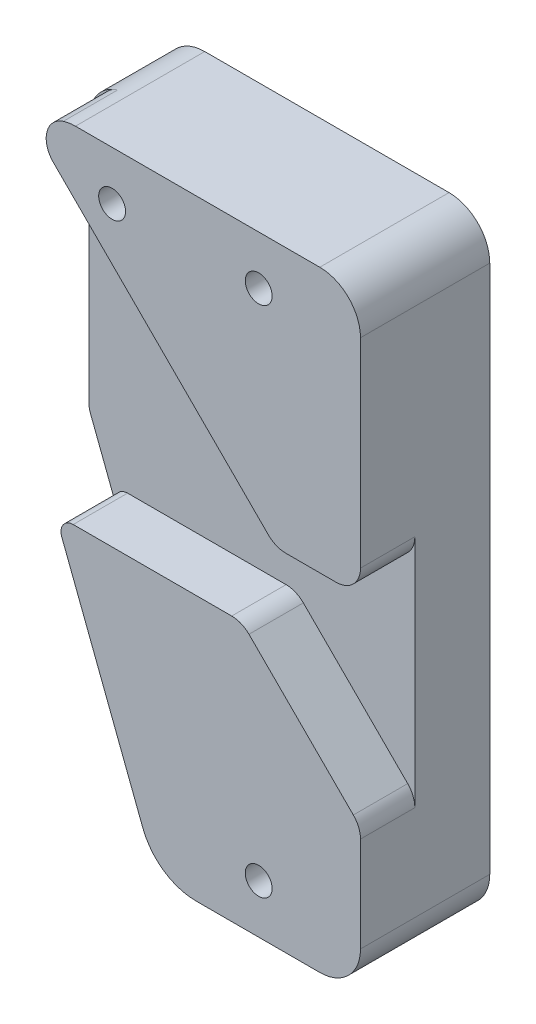
from build123d import *
from build123d.topology import SkipClean

# Parameters (mm, degrees)
SKETCH1_R           = 1.5
SKETCH1_W           = 15
SKETCH1_H           = 37.5
BOSS_EXTRUDE1_DEPTH = 2.85
FILLET1_R           = 5
FILLET2_R           = 2
BOSS_EXTRUDE2_START = 3.5
SKETCH5_R           = 1.5
BOSS_EXTRUDE2_DEPTH = 3.5
FILLET3_R           = 3.5
FILLET4_R           = 2
FILLET5_R           = 2
SKETCH6_R           = 1.5
CUT_EXTRUDE1_DEPTH  = 10
SKETCH8_R           = 1.5
BOSS_EXTRUDE3_DEPTH = 6.35
BOSS_EXTRUDE4_START = 3.175
SKETCH9_R           = 1.5
BOSS_EXTRUDE4_DEPTH = 3.175
SKETCH10_W          = 40
SKETCH10_H          = 15.399494937
SKETCH10_W_2        = 25
BOSS_EXTRUDE5_DEPTH = 6.675
CUT_EXTRUDE2_START  = -6.675
CUT_EXTRUDE2_DEPTH  = 6.675
BOSS_EXTRUDE6_START = -9.2
BOSS_EXTRUDE6_DEPTH = 9.2
FILLET6_R           = 7
BOSS_EXTRUDE7_DEPTH = 6.675
FILLET7_R           = 3
FILLET8_R           = 1.5
SKETCH15_R          = 1.65
CUT_EXTRUDE3_DEPTH  = 81.63507689


# Read off the part's stored shape, not the designer's step: Cut-Extrude2
with BuildPart() as part:
    # Sketch1 → Boss-Extrude1 (new body)
    # profile 1 of 2: a face of its own
    with BuildSketch(Plane.XY):
        Polygon((0, 37.5), (0, 0), (25, 0), (25, 75), (0, 75), align=None)
        with Locations((12.5, 6)):
            Circle(SKETCH1_R, mode=Mode.SUBTRACT)
        with Locations((12.5, 37.5)):
            Circle(SKETCH1_R, mode=Mode.SUBTRACT)
        with Locations((12.5, 69)):
            Circle(SKETCH1_R, mode=Mode.SUBTRACT)
    # profile 2 of 2: a face of its own
    with BuildSketch(Plane.XY):
        with Locations((-7.5, 56.25)):
            Rectangle(SKETCH1_W, SKETCH1_H)
    extrude(amount=BOSS_EXTRUDE1_DEPTH)

    # Fillet1
    fillet1_edges = [part.edges().sort_by_distance(p)[0] for p in [
        (25, 75, 1.425),
        (25, 0, 1.425),
        (0, 0, 1.425),
        (0, 37.5, 1.425),
        (-15, 75, 1.425),
    ]]
    fillet(fillet1_edges, radius=FILLET1_R)

    # Fillet2
    fillet2_edges = [part.edges().sort_by_distance(p)[0] for p in [
        (-15, 37.5, 1.425),
    ]]
    fillet(fillet2_edges, radius=FILLET2_R)

    # Sketch5 → Boss-Extrude2 (add)
    # profile 1 of 2: a face of its own
    with BuildSketch(Plane.XY.offset(2.85).offset(BOSS_EXTRUDE2_START)):
        with BuildLine():
            Line((-15, 42.5), (10.428932188, 42.5))
            Line((10.428932188, 42.5), (21.464466094, 53.535533906))
            Line((21.464466094, 53.535533906), (25, 57.071067812))
            Line((25, 57.071067812), (25, 70))
            ThreePointArc((25, 70), (23.535533906, 73.535533906), (20, 75))
            Line((20, 75), (-10, 75))
            ThreePointArc((-10, 75), (-13.535533906, 73.535533906), (-15, 70))
            Line((-15, 70), (-15, 42.5))
        make_face()
        with Locations((12.5, 69)):
            Circle(SKETCH5_R, mode=Mode.SUBTRACT)
    # profile 2 of 2: a face of its own
    with BuildSketch(Plane.XY.offset(2.85).offset(BOSS_EXTRUDE2_START)):
        with BuildLine():
            Line((14.571067812, 32.5), (0, 17.928932188))
            Line((0, 17.928932188), (0, 5))
            ThreePointArc((0, 5), (1.464466094, 1.464466094), (5, 0))
            Line((5, 0), (20, 0))
            ThreePointArc((20, 0), (23.535533906, 1.464466094), (25, 5))
            Line((25, 5), (25, 32.5))
            Line((25, 32.5), (14.571067812, 32.5))
        make_face()
        with Locations((12.5, 6)):
            Circle(SKETCH5_R, mode=Mode.SUBTRACT)
    extrude(amount=-BOSS_EXTRUDE2_DEPTH)

    # Fillet3
    fillet3_edges = [part.edges().sort_by_distance(p)[0] for p in [
        (10.428932188, 42.5, 4.6),
        (14.571067812, 32.5, 4.6),
    ]]
    fillet(fillet3_edges, radius=FILLET3_R)

    # Fillet4
    fillet4_edges = [part.edges().sort_by_distance(p)[0] for p in [
        (-15, 42.5, 4.6),
    ]]
    fillet(fillet4_edges, radius=FILLET4_R)

    # Fillet5
    fillet5_edges = [part.edges().sort_by_distance(p)[0] for p in [
        (25, 57.071067812, 4.6),
        (25, 32.5, 4.6),
        (0, 17.928932188, 4.6),
    ]]
    fillet(fillet5_edges, radius=FILLET5_R)

    # Sketch6 → Cut-Extrude1 (cut)
    with BuildSketch(Plane.XY.offset(6.35)):
        with Locations((-5.5, 69)):
            Circle(SKETCH6_R)
    extrude(amount=-CUT_EXTRUDE1_DEPTH, mode=Mode.SUBTRACT)

    # Sketch8 → Boss-Extrude3 (add)
    with SkipClean():  # the faces are left unmerged after this step: merging them gives an invalid solid
        with BuildSketch(Plane(origin=(0, 0, 0), x_dir=(-1, 0, 0), z_dir=(0, 0, -1))):
            with BuildLine():
                ThreePointArc((0, 32.5), (1.464466094, 36.035533906), (5, 37.5))
                Line((5, 37.5), (13, 37.5))
                ThreePointArc((13, 37.5), (14.414213562, 38.085786438), (15, 39.5))
                Line((15, 39.5), (15, 70))
                ThreePointArc((15, 70), (13.535533906, 73.535533906), (10, 75))
                Line((10, 75), (-20, 75))
                ThreePointArc((-20, 75), (-23.535533906, 73.535533906), (-25, 70))
                Line((-25, 70), (-25, 5))
                ThreePointArc((-25, 5), (-23.535533906, 1.464466094), (-20, 0))
                Line((-20, 0), (-5, 0))
                ThreePointArc((-5, 0), (-1.464466094, 1.464466094), (0, 5))
                Line((0, 5), (0, 32.5))
            make_face()
            with Locations((-12.5, 6)):
                Circle(SKETCH8_R, mode=Mode.SUBTRACT)
            with Locations((-12.5, 69)):
                Circle(SKETCH8_R, mode=Mode.SUBTRACT)
            with Locations((-12.5, 37.5)):
                Circle(SKETCH8_R, mode=Mode.SUBTRACT)
            with Locations(Location((5.5, 69, 0), (0, 0, 180))):
                Circle(SKETCH8_R, mode=Mode.SUBTRACT)
        extrude(amount=BOSS_EXTRUDE3_DEPTH)
    add(part.part.scale(1), mode=Mode.REPLACE)  # the faces are merged on a copy

    # Sketch9 → Boss-Extrude4 (add)
    # profile 1 of 2: a face of its own
    with BuildSketch(Plane.XY.offset(6.35).offset(BOSS_EXTRUDE4_START)):
        with BuildLine():
            ThreePointArc((16.02081528, 32.5), (14.681423267, 32.233578364), (13.545941546, 31.474873734))
            Line((13.545941546, 31.474873734), (0.585786438, 18.514718626))
            ThreePointArc((0.585786438, 18.514718626), (0.152240935, 17.865871928), (0, 17.100505063))
            Line((0, 17.100505063), (0, 5))
            ThreePointArc((0, 5), (1.464466094, 1.464466094), (5, 0))
            Line((5, 0), (20, 0))
            ThreePointArc((20, 0), (23.535533906, 1.464466094), (25, 5))
            Line((25, 5), (25, 30.5))
            ThreePointArc((25, 30.5), (24.414213562, 31.914213562), (23, 32.5))
            Line((23, 32.5), (16.02081528, 32.5))
        make_face()
    # profile 2 of 2: a face of its own
    with BuildSketch(Plane.XY.offset(6.35).offset(BOSS_EXTRUDE4_START)):
        with BuildLine():
            ThreePointArc((8.97918472, 42.5), (10.318576733, 42.766421636), (11.454058454, 43.525126266))
            Line((11.454058454, 43.525126266), (24.414213562, 56.485281374))
            ThreePointArc((24.414213562, 56.485281374), (24.847759065, 57.134128072), (25, 57.899494937))
            Line((25, 57.899494937), (25, 70))
            ThreePointArc((25, 70), (23.535533906, 73.535533906), (20, 75))
            Line((20, 75), (-10, 75))
            ThreePointArc((-10, 75), (-13.535533906, 73.535533906), (-15, 70))
            Line((-15, 70), (-15, 44.5))
            ThreePointArc((-15, 44.5), (-14.414213562, 43.085786438), (-13, 42.5))
            Line((-13, 42.5), (8.97918472, 42.5))
        make_face()
        with Locations((-5.5, 69)):
            Circle(SKETCH9_R, mode=Mode.SUBTRACT)
        with Locations((12.5, 69)):
            Circle(SKETCH9_R, mode=Mode.SUBTRACT)
    extrude(amount=-BOSS_EXTRUDE4_DEPTH)

    # Sketch10 → Boss-Extrude5 (add)
    with SkipClean():  # the faces are left unmerged after this step: merging them gives an invalid solid
        with BuildSketch(Plane.XY.offset(9.525)):
            with Locations((5, 50.199747469)):
                Rectangle(SKETCH10_W, SKETCH10_H)
            with Locations((12.5, 24.800252531)):
                Rectangle(SKETCH10_W_2, SKETCH10_H)
        extrude(amount=-BOSS_EXTRUDE5_DEPTH)

    # Cut-Extrude2 outline → Cut-Extrude2 (cut)
    with SkipClean():  # the faces are left unmerged after this step: merging them gives an invalid solid
        with BuildSketch(Plane.XY.offset(9.525).offset(CUT_EXTRUDE2_START)):
            Polygon((25, 32.5), (10.428932188, 32.5), (25, 17.928932188), align=None)
            with BuildLine():
                Line((-15, 42.5), (14.571067812, 42.5))
                Line((14.571067812, 42.5), (-14.682437359, 71.75350517))
                ThreePointArc((-14.682437359, 71.75350517), (-14.919968841, 70.891014367), (-15, 70))
                Line((-15, 70), (-15, 42.5))
            make_face()
        extrude(amount=CUT_EXTRUDE2_DEPTH, mode=Mode.SUBTRACT)

    # Sketch12 → Boss-Extrude6 (add)
    with BuildSketch(Plane(origin=(0, 0, -6.35), x_dir=(-1, 0, 0), z_dir=(0, 0, -1)).offset(BOSS_EXTRUDE6_START)):
        with BuildLine():
            Line((0, 0), (14.867488321, 38.784117768))
            ThreePointArc((14.867488321, 38.784117768), (14.133189202, 37.852006604), (13, 37.5))
            Line((13, 37.5), (5, 37.5))
            ThreePointArc((5, 37.5), (1.464466094, 36.035533906), (0, 32.5))
            Line((0, 32.5), (0, 5))
            ThreePointArc((0, 5), (-1.464466094, 1.464466094), (-5, 0))
            Line((-5, 0), (0, 0))
        make_face()
    extrude(amount=BOSS_EXTRUDE6_DEPTH)

    # Fillet6
    fillet6_edges = [part.edges().sort_by_distance(p)[0] for p in [
        (0, 0, -1.75),
    ]]
    fillet(fillet6_edges, radius=FILLET6_R)

    # Sketch13 → Boss-Extrude7 (add)
    with SkipClean():  # the faces are left unmerged after this step: merging them gives an invalid solid
        with BuildSketch(Plane.XY.offset(9.525)):
            with BuildLine():
                Line((0, 32.5), (0, 5))
                ThreePointArc((0, 5), (1.464466094, 1.464466094), (5, 0))
                Line((5, 0), (4.813322939, 0))
                ThreePointArc((4.813322939, 0), (0.847160732, 1.232023115), (-1.722886185, 4.494412187))
                Line((-1.722886185, 4.494412187), (-12.458537109, 32.5))
                Line((-12.458537109, 32.5), (0, 32.5))
            make_face()
        extrude(amount=-BOSS_EXTRUDE7_DEPTH)

    # Fillet7
    fillet7_edges = [part.edges().sort_by_distance(p)[0] for p in [
        (25, 42.5, 6.1875),
        (14.571067812, 42.5, 6.1875),
        (-14.682437359, 71.75350517, 4.6),
        (10.428932188, 32.5, 6.1875),
        (25, 17.928932188, 6.1875),
    ]]
    fillet(fillet7_edges, radius=FILLET7_R)

    # Fillet8
    # the kernel refuses this fillet: 1.5 mm, written as the material it takes off along each edge
    with BuildSketch(Plane(origin=(-12.458537109, 32.5, 14.978612885), x_dir=(0.35794111613384066, -0.9337441605605148, 0), z_dir=(0, 0, -1))) as fillet8_piece_1:
        with BuildLine():
            CenterArc((FILLET8_R * 1.45429676938, -FILLET8_R), FILLET8_R, 90, 110.97380664)
            Line((FILLET8_R * 0.520552608823, -FILLET8_R * 1.35794111613), (0, 0))
            Line((0, 0), (FILLET8_R * 1.45429676938, 0))
        make_face()
    extrude(amount=12.128612885, mode=Mode.SUBTRACT)

    # Sketch15 → Cut-Extrude3 (cut, through all)
    with BuildSketch(Plane(origin=(0, 0, -6.35), x_dir=(-1, 0, 0), z_dir=(0, 0, -1))):
        with Locations((-12.5, 69)):
            Circle(SKETCH15_R)
        with Locations((-12.5, 37.5)):
            Circle(SKETCH15_R)
        with Locations((-12.5, 6)):
            Circle(SKETCH15_R)
        with Locations((5.5, 69)):
            Circle(SKETCH15_R)
    extrude(amount=-CUT_EXTRUDE3_DEPTH, mode=Mode.SUBTRACT)


solid = part.part
